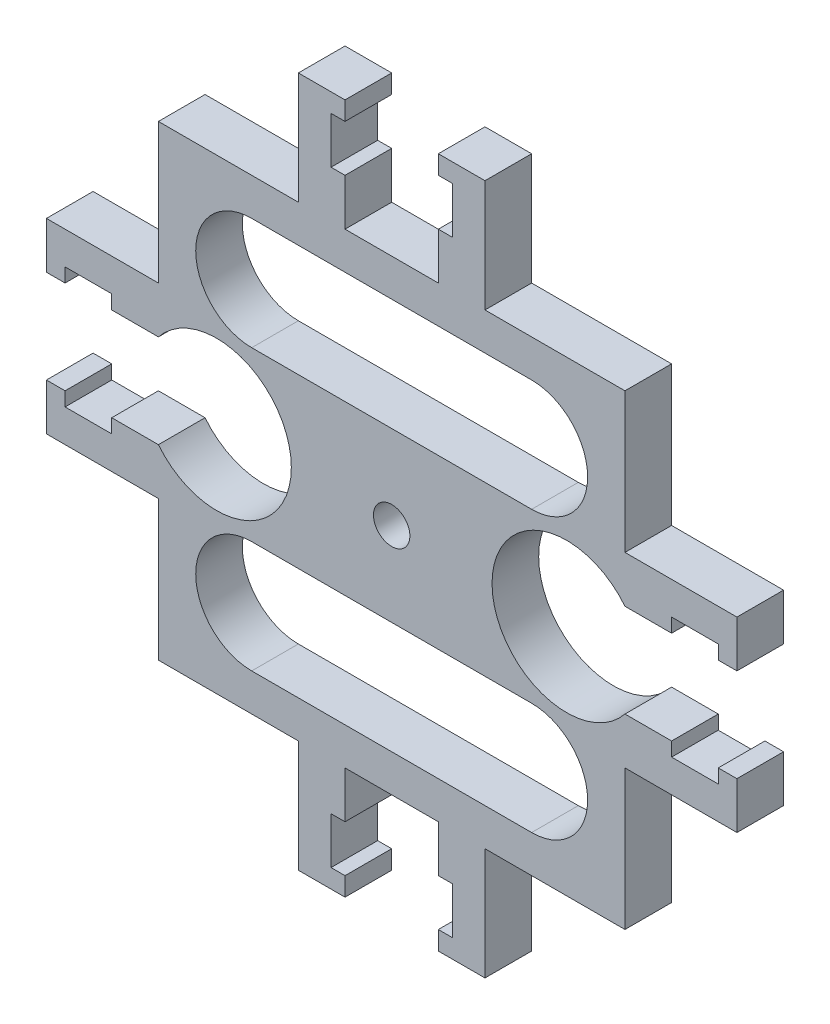
from build123d import *

# Parameters (mm, degrees)
ESQUISSE1_R        = 1.95
BOSS_EXTRU_1_DEPTH = 5


with BuildPart() as part:
    # Esquisse1 → Boss.-Extru.1 (new body)
    with BuildSketch(Plane.XY):
        with BuildLine():
            Line((-10, 25), (-25, 25))
            Line((-25, 25), (-25, 10))
            Line((-25, 10), (-30, 10))
            Line((-30, 10), (-37, 10))
            Line((-37, 10), (-37, 5))
            Line((-37, 5), (-35, 5))
            Line((-35, 5), (-35, 6.5))
            Line((-35, 6.5), (-30, 6.5))
            Line((-30, 6.5), (-30, 5))
            Line((-30, 5), (-25, 5))
            ThreePointArc((-25, 5), (-10.755002002, 0), (-25, -5))
            Line((-25, -5), (-30, -5))
            Line((-30, -5), (-30, -6.5))
            Line((-30, -6.5), (-35, -6.5))
            Line((-35, -6.5), (-35, -5))
            Line((-35, -5), (-37, -5))
            Line((-37, -5), (-37, -10))
            Line((-37, -10), (-30, -10))
            Line((-30, -10), (-25, -10))
            Line((-25, -10), (-25, -25))
            Line((-25, -25), (-10, -25))
            Line((-10, -25), (-10, -30))
            Line((-10, -30), (-10, -37))
            Line((-10, -37), (-5, -37))
            Line((-5, -37), (-5, -35))
            Line((-5, -35), (-6.5, -35))
            Line((-6.5, -35), (-6.5, -30))
            Line((-6.5, -30), (-5, -30))
            Line((-5, -30), (-5, -25))
            Line((-5, -25), (0, -25))
            Line((0, -25), (5, -25))
            Line((5, -25), (5, -30))
            Line((5, -30), (6.5, -30))
            Line((6.5, -30), (6.5, -35))
            Line((6.5, -35), (5, -35))
            Line((5, -35), (5, -37))
            Line((5, -37), (10, -37))
            Line((10, -37), (10, -30))
            Line((10, -30), (10, -25))
            Line((10, -25), (25, -25))
            Line((25, -25), (25, -10))
            Line((25, -10), (30, -10))
            Line((30, -10), (37, -10))
            Line((37, -10), (37, -5))
            Line((37, -5), (35, -5))
            Line((35, -5), (35, -6.5))
            Line((35, -6.5), (30, -6.5))
            Line((30, -6.5), (30, -5))
            Line((30, -5), (25, -5))
            ThreePointArc((25, -5), (10.755002002, 0), (25, 5))
            Line((25, 5), (30, 5))
            Line((30, 5), (30, 6.5))
            Line((30, 6.5), (35, 6.5))
            Line((35, 6.5), (35, 5))
            Line((35, 5), (37, 5))
            Line((37, 5), (37, 10))
            Line((37, 10), (30, 10))
            Line((30, 10), (25, 10))
            Line((25, 10), (25, 25))
            Line((25, 25), (10, 25))
            Line((10, 25), (10, 30))
            Line((10, 30), (10, 37))
            Line((10, 37), (5, 37))
            Line((5, 37), (5, 35))
            Line((5, 35), (6.5, 35))
            Line((6.5, 35), (6.5, 30))
            Line((6.5, 30), (5, 30))
            Line((5, 30), (5, 25))
            Line((5, 25), (0, 25))
            Line((0, 25), (-5, 25))
            Line((-5, 25), (-5, 30))
            Line((-5, 30), (-6.5, 30))
            Line((-6.5, 30), (-6.5, 35))
            Line((-6.5, 35), (-5, 35))
            Line((-5, 35), (-5, 37))
            Line((-5, 37), (-10, 37))
            Line((-10, 37), (-10, 30))
            Line((-10, 30), (-10, 25))
        make_face()
        Circle(ESQUISSE1_R, mode=Mode.SUBTRACT)
        with BuildLine():
            Line((15, -21), (-15, -21))
            ThreePointArc((-15, -21), (-21, -15), (-15, -9))
            Line((-15, -9), (15, -9))
            ThreePointArc((15, -9), (21, -15), (15, -21))
        make_face(mode=Mode.SUBTRACT)
        with BuildLine():
            ThreePointArc((-15, 9), (-21, 15), (-15, 21))
            Line((-15, 21), (15, 21))
            ThreePointArc((15, 21), (21, 15), (15, 9))
            Line((15, 9), (-15, 9))
        make_face(mode=Mode.SUBTRACT)
    extrude(amount=BOSS_EXTRU_1_DEPTH)


solid = part.part
